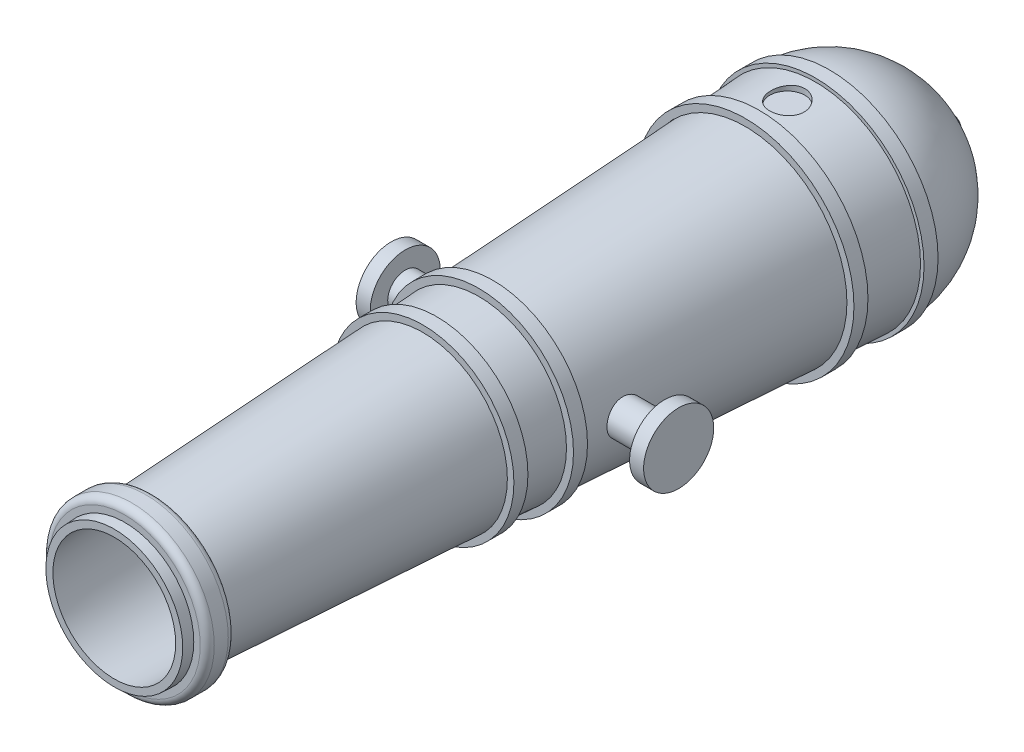
from build123d import *

# Parameters (mm, degrees)
SKETCH1_R           = 190.5
BOSS_EXTRUDE1_DEPTH = 1270
BOSS_EXTRUDE1_TAPER = 3
SKETCH5_R           = 190.5
BOSS_EXTRUDE3_DEPTH = 25.4
REVOLVE1_ANGLE      = 180
SKETCH4_R           = 196.85
SKETCH4_R_2         = 190.5
BOSS_EXTRUDE2_DEPTH = 25.4
SKETCH8_R           = 149.342120311
SKETCH8_R_2         = 123.942120311
BOSS_EXTRUDE4_DEPTH = 50.8
FILLET1_R           = 12.7
SKETCH10_R          = 196.85
SKETCH10_R_2        = 184.15
BOSS_EXTRUDE5_DEPTH = 25.4
SKETCH11_R          = 31.75
CUT_EXTRUDE1_DEPTH  = 19.05
SKETCH12_R          = 165.1
BOSS_EXTRUDE6_DEPTH = 25.4
SKETCH13_R          = 171.45
SKETCH13_R_2        = 158.75
BOSS_EXTRUDE7_DEPTH = 25.4
BOSS_EXTRUDE8_START = -15.24
SKETCH15_R          = 31.75
BOSS_EXTRUDE8_DEPTH = 78.74
SKETCH16_R          = 63.5
BOSS_EXTRUDE9_DEPTH = 25.4


# Read off the part's stored shape, not the designer's step: Shell1
with BuildPart() as part:
    # Sketch1 → Boss-Extrude1 (new body)
    with BuildSketch(Plane.XY):
        Circle(SKETCH1_R)
    extrude(amount=BOSS_EXTRUDE1_DEPTH, taper=BOSS_EXTRUDE1_TAPER)

    # Sketch5 → Boss-Extrude3 (add)
    with BuildSketch(Plane(origin=(0, 0, 0), x_dir=(-1, 0, 0), z_dir=(0, 0, -1))):
        Circle(SKETCH5_R)
    extrude(amount=BOSS_EXTRUDE3_DEPTH)

    # Sketch2 → Revolve1 (revolve)
    with BuildSketch(Plane(origin=(0, 0, -25.4), x_dir=(-1, 0, 0), z_dir=(0, 0, -1))):
        with BuildLine():
            Line((-190.5, 0), (190.5, 0))
            ThreePointArc((190.5, 0), (0, -190.5), (-190.5, 0))
        make_face()
    revolve(axis=Axis((249.150886089, 0, -25.4), (1, 0, 0)), revolution_arc=REVOLVE1_ANGLE)

    # Shell1 outline → Shell1 (revolve, cut)
    with BuildSketch(Plane.XZ):
        with BuildLine():
            ThreePointArc((0, -203.2), (125.723585707, -151.123585683), (177.8, -25.399999967))
            Line((177.8, -25.399999967), (177.8, -0.332561204))
            Line((177.8, -0.332561204), (111.224691516, 1270))
            Line((111.224691516, 1270), (0, 1270))
            Line((0, 1270), (0, -203.2))
        make_face()
    revolve(axis=Axis((0, 0, 0), (0, 0, 1)), mode=Mode.SUBTRACT)

    # Sketch3 → Revolve2 (revolve)
    with BuildSketch(Plane.XY.offset(-228.6)):
        with BuildLine():
            Line((25.4, 0), (-25.4, 0))
            ThreePointArc((-25.4, 0), (0, -25.4), (25.4, 0))
        make_face()
    revolve(axis=Axis((190.5, 0, -228.6), (-1, 0, 0)))

    # Sketch8 → Boss-Extrude4 (add)
    with BuildSketch(Plane.XY.offset(1250.95)):
        Circle(SKETCH8_R)
        Circle(SKETCH8_R_2, mode=Mode.SUBTRACT)
    extrude(amount=-BOSS_EXTRUDE4_DEPTH)

    # Fillet1
    fillet1_edges = [part.edges().sort_by_distance(p)[0] for p in [
        (-149.342120311, 0, 1200.15),
        (-149.342120311, 0, 1250.95),
    ]]
    fillet(fillet1_edges, radius=FILLET1_R)

    # Sketch10 → Boss-Extrude5 (add)
    with BuildSketch(Plane.XY.offset(127)):
        Circle(SKETCH10_R)
        Circle(SKETCH10_R_2, mode=Mode.SUBTRACT)
    extrude(amount=-BOSS_EXTRUDE5_DEPTH)

    # Sketch11 → Cut-Extrude1 (cut)
    with BuildSketch(Plane(origin=(0, 198.12, 0), x_dir=(1, 0, 0), z_dir=(0, 1, 0))):
        with Locations(Location((0, -50.8, 0), (0, 0, 270))):
            Circle(SKETCH11_R)
    extrude(amount=-CUT_EXTRUDE1_DEPTH, mode=Mode.SUBTRACT)

    # Sketch12 → Boss-Extrude6 (add)
    with BuildSketch(Plane.XY.offset(711.2)):
        Circle(SKETCH12_R)
    extrude(amount=-BOSS_EXTRUDE6_DEPTH)

    # Sketch13 → Boss-Extrude7 (add)
    with BuildSketch(Plane.XY.offset(609.6)):
        Circle(SKETCH13_R)
        Circle(SKETCH13_R_2, mode=Mode.SUBTRACT)
    extrude(amount=-BOSS_EXTRUDE7_DEPTH)

    # Sketch15 → Boss-Extrude8 (add)
    with BuildSketch(Plane(origin=(171.45, 0, 0), x_dir=(0, 0, -1), z_dir=(1, 0, 0)).offset(BOSS_EXTRUDE8_START)):
        with Locations((-508, 0)):
            Circle(SKETCH15_R)
    boss_extrude8 = extrude(amount=BOSS_EXTRUDE8_DEPTH)

    # Sketch16 → Boss-Extrude9 (add)
    with BuildSketch(Plane(origin=(234.95, 0, 0), x_dir=(0, 0, -1), z_dir=(1, 0, 0))):
        with Locations((-508, 0)):
            Circle(SKETCH16_R)
    boss_extrude9 = extrude(amount=BOSS_EXTRUDE9_DEPTH)

    # Mirror1: Boss-Extrude8, Boss-Extrude9 across plane
    add(boss_extrude8.mirror(Plane(origin=(0, 0, 0), x_dir=(0, 0, 1), z_dir=(1, 0, 0))))
    add(boss_extrude9.mirror(Plane(origin=(0, 0, 0), x_dir=(0, 0, 1), z_dir=(1, 0, 0))))


with BuildPart() as body_2:
    # Sketch4 → Boss-Extrude2 (new body)
    with BuildSketch(Plane.XY):
        Circle(SKETCH4_R)
        Circle(SKETCH4_R_2, mode=Mode.SUBTRACT)
    extrude(amount=-BOSS_EXTRUDE2_DEPTH)


solid = Compound([part.part, body_2.part])
